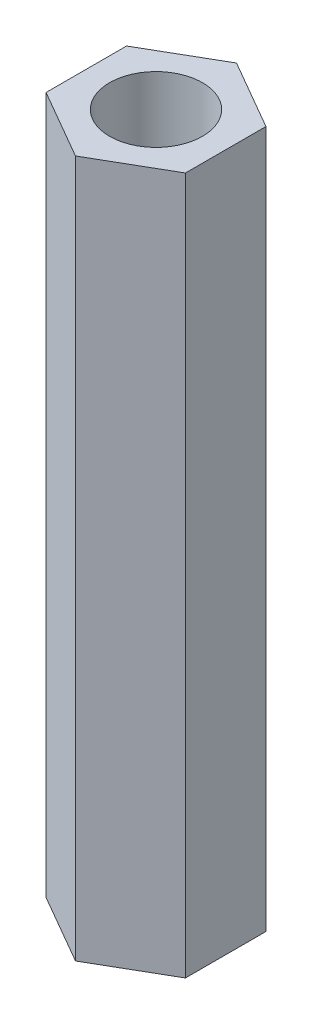
from build123d import *

# Parameters (mm, degrees)
SKETCH1_R           = 1
BOSS_EXTRUDE1_DEPTH = 15


with BuildPart() as part:
    # Sketch1 → Boss-Extrude1 (new body)
    with BuildSketch(Plane(origin=(0, 0, 0), x_dir=(1, 0, 0), z_dir=(0, 1, 0))):
        Polygon((0, -1.732050808), (1.5, -0.866025404), (1.5, 0.866025404), (0, 1.732050808), (-1.5, 0.866025404), (-1.5, -0.866025404), align=None)
        Circle(SKETCH1_R, mode=Mode.SUBTRACT)
    extrude(amount=BOSS_EXTRUDE1_DEPTH)


solid = part.part
